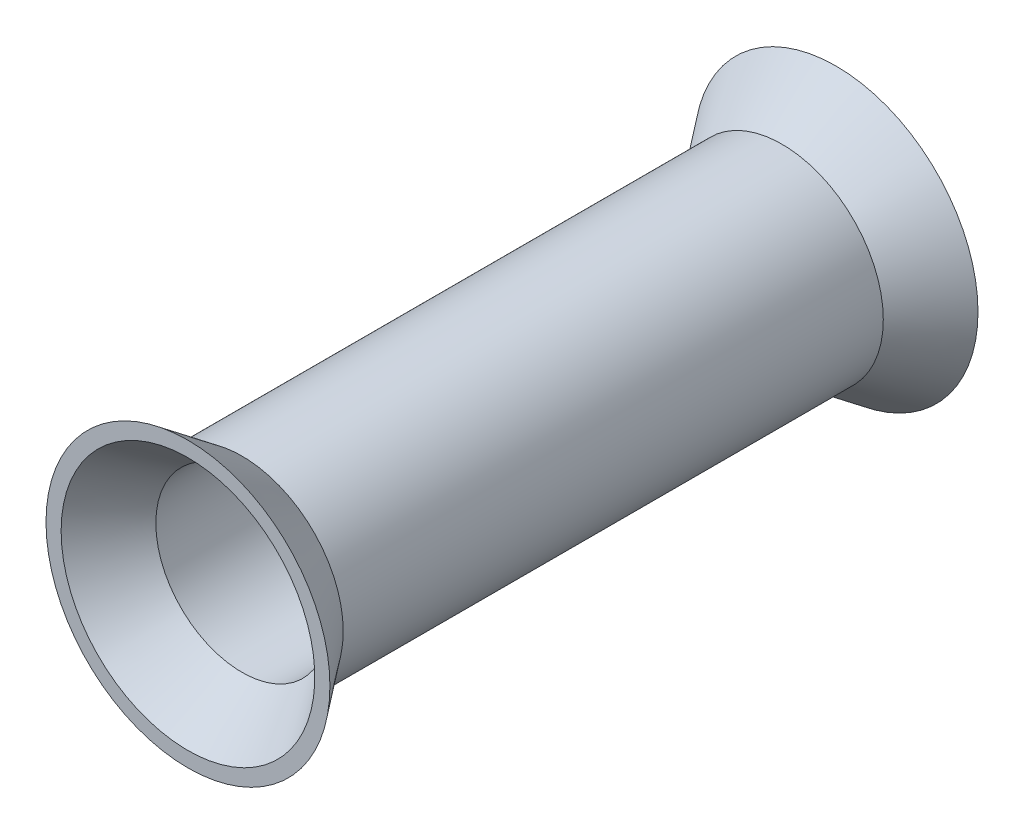
from build123d import *

# Parameters (mm, degrees)
SKETCH2_R           = 4.7625
SKETCH2_R_2         = 4.0513
BOSS_EXTRUDE1_DEPTH = 12.7
SKETCH4_R           = 4.7625
BOSS_EXTRUDE2_DEPTH = 2.54
BOSS_EXTRUDE2_TAPER = -37


with BuildPart() as part:
    # Sketch2 → Boss-Extrude1 (new, symmetric)
    with BuildSketch(Plane.XY):
        Circle(SKETCH2_R)
        Circle(SKETCH2_R_2, mode=Mode.SUBTRACT)
    extrude(amount=BOSS_EXTRUDE1_DEPTH, both=True)

    # Sketch4 → Boss-Extrude2 (add)
    with BuildSketch(Plane(origin=(0, 0, -12.7), x_dir=(-1, 0, 0), z_dir=(0, 0, -1))):
        Circle(SKETCH4_R)
    boss_extrude2 = extrude(amount=BOSS_EXTRUDE2_DEPTH, taper=BOSS_EXTRUDE2_TAPER)

    # Cut-Extrude2 cone 1 section (through the dimple's axis) → Cut-Extrude2 (revolve, cut)
    with BuildSketch(Plane(origin=(0, 0, -15.24), x_dir=(0, 1, 0), z_dir=(1, 0, 0))):
        Polygon((0, 0), (5.965327287, 0), (0, 7.916256686), align=None)
    cut_extrude2 = revolve(axis=Axis((0, 0, -15.24), (0, 0, 1)), mode=Mode.SUBTRACT)

    # Mirror1: Boss-Extrude2, Cut-Extrude2 across plane
    add(boss_extrude2.mirror(Plane.XY))
    add(cut_extrude2.mirror(Plane.XY), mode=Mode.SUBTRACT)


solid = part.part
